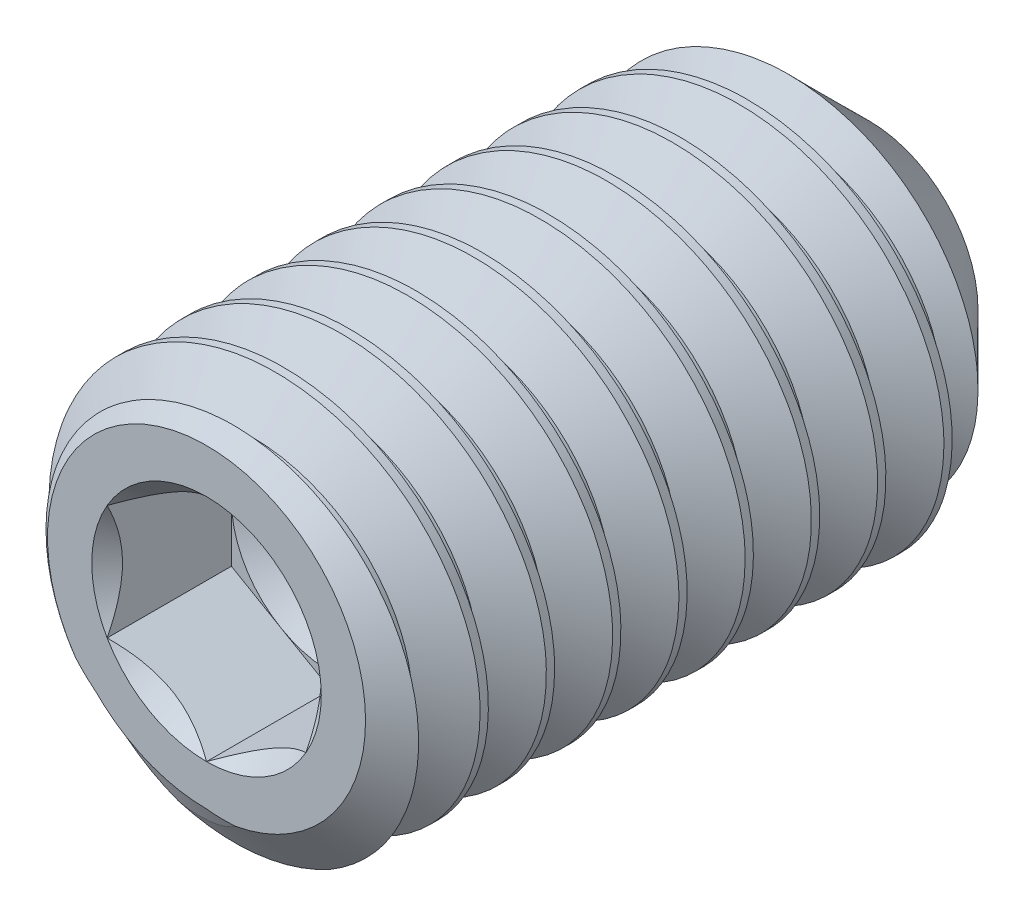
from build123d import *

# Parameters (mm, degrees)
CUT_SWEEP2_PITCH    = 1
CUT_EXTRUDE10_DEPTH = 1.875


with BuildPart() as part:
    # Sketch22 → Revolve1 (revolve)
    with BuildSketch(Plane(origin=(0, 0, 0), x_dir=(0, 0, -1), z_dir=(1, 0, 0)), mode=Mode.PRIVATE) as revolve1_sk:
        Polygon((-4.506124201, 0), (-4.506124201, 2.4), (-4.085999678, 3), (4.137770518, 3), (5.493875799, 1.643894719), (4.506124201, 0), align=None)
    revolve(revolve1_sk.sketch.rotate(Axis((0, 0, -4.506124201), (0, 0, -1)), 180), axis=Axis((0, 0, -4.506124201), (0, 0, -1)))

    # Cut-Sweep2: the profile of Sketch28 profile screwed along a right-hand helix of 11 turns, 8 arcs to a turn; built about Z, then put on its axis
    cut_sweep2_z = Axis((0, 0, 0), (0, 0, 1))
    cut_sweep2_corners = [(3.0003, 0, 0.000173205), (3.0003, 0, -0.875173205), (2.350480947, 0, -0.5), (2.350480947, 0, -0.375)]
    with BuildLine(mode=Mode.PRIVATE) as cut_sweep2_profile:
        Line(cut_sweep2_corners[0], cut_sweep2_corners[1])
        Line(cut_sweep2_corners[1], cut_sweep2_corners[2])
        Line(cut_sweep2_corners[2], cut_sweep2_corners[3])
        Line(cut_sweep2_corners[3], cut_sweep2_corners[0])
    cut_sweep2_cap = Face(cut_sweep2_profile.wire())
    cut_sweep2_turn_angles = [0, 22.5, 45, 67.5, 90, 112.5, 135, 157.5, 180, 202.5, 225, 247.5, 270, 292.5, 315, 337.5, 360]
    cut_sweep2_turn_weights = [1, 0.9238795325112867, 1, 0.9238795325112867, 1, 0.9238795325112867, 1, 0.9238795325112867, 1, 0.9238795325112867, 1, 0.9238795325112867, 1, 0.9238795325112867, 1, 0.9238795325112867, 1]
    cut_sweep2_turn_rails = [Edge.make_bspline([Vector(p[0], p[1], 0).rotate(cut_sweep2_z, cut_sweep2_turn_angles[k]) / cut_sweep2_turn_weights[k] + Vector(0, 0, p[2] + CUT_SWEEP2_PITCH * cut_sweep2_turn_angles[k] / 360) for k in range(17)], [0, 0, 0, 1, 1, 2, 2, 3, 3, 4, 4, 5, 5, 6, 6, 7, 7, 8, 8, 8], 2, cut_sweep2_turn_weights) for p in cut_sweep2_corners]
    cut_sweep2_turn_sides = [Face.make_surface_from_curves(cut_sweep2_turn_rails[p[0]], cut_sweep2_turn_rails[p[1]]) for p in [(0, 1), (1, 2), (2, 3), (3, 0)]]
    cut_sweep2 = Plane(origin=(0, 0, -5.493875799), x_dir=(0, 1, 0), z_dir=(0, 0, 1)) * Solid(Shell([*[p.moved(Location((0, 0, CUT_SWEEP2_PITCH * i))) for i in range(11) for p in cut_sweep2_turn_sides], cut_sweep2_cap, cut_sweep2_cap.rotate(cut_sweep2_z, 3960).moved(Location((0, 0, CUT_SWEEP2_PITCH * 3960 / 360)))]))
    add(cut_sweep2, mode=Mode.SUBTRACT)

    # Sketch23 → Cut-Extrude10 (cut)
    with BuildSketch(Plane.XY.offset(4.506124201)):
        Polygon((0, 1.732050808), (-1.5, 0.866025404), (-1.5, -0.866025404), (0, -1.732050808), (1.5, -0.866025404), (1.5, 0.866025404), align=None)
    extrude(amount=-CUT_EXTRUDE10_DEPTH, mode=Mode.SUBTRACT)

    # Cut-Extrude11 cone 1 section (through the dimple's axis) → Cut-Extrude11 (revolve, cut)
    with BuildSketch(Plane(origin=(0, 0, 4.506124201), x_dir=(0, -1, 0), z_dir=(1, 0, 0))):
        Polygon((0, 0), (1.732050808, 0), (0, 1.732050808), align=None)
    revolve(axis=Axis((0, 0, 4.506124201), (0, 0, -1)), mode=Mode.SUBTRACT)

    # Cut-Extrude12 cone 1 section (through the dimple's axis) → Cut-Extrude12 (revolve, cut)
    with BuildSketch(Plane(origin=(0, 0, 2.631124201), x_dir=(0, -1, 0), z_dir=(1, 0, 0))):
        Polygon((0, 0), (1.5, 0), (0, 0.866025404), align=None)
    revolve(axis=Axis((0, 0, 2.631124201), (0, 0, -1)), mode=Mode.SUBTRACT)


solid = part.part
